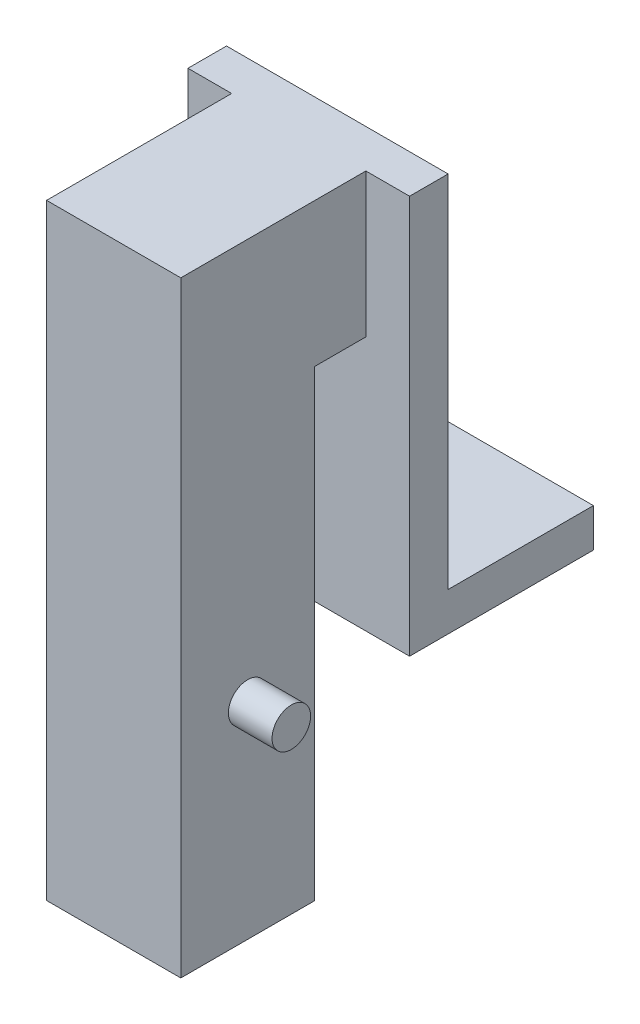
from build123d import *

# Parameters (mm, degrees)
SKETCH1_W           = 10.442861366
SKETCH1_H           = 47.180745659
BOSS_EXTRUDE1_DEPTH = 10.4
SKETCH2_W           = 4.442861366
SKETCH2_H           = 4.4
CUT_EXTRUDE1_DEPTH  = 25
WRAP1_START         = 6.090842934
WRAP1_OUTLINE_R     = 1.5
WRAP1_DEPTH         = 3.4
WRAP2_START         = -7.752018432
WRAP2_OUTLINE_R     = 1.5
WRAP2_DEPTH         = 3.4
SKETCH9_W           = 14.4
SKETCH9_H           = 11.180745659
BOSS_EXTRUDE2_DEPTH = 10.442861366
SKETCH10_W          = 17.242861366
SKETCH10_H          = 28
BOSS_EXTRUDE3_DEPTH = 3
SKETCH11_W          = 17.242861366
SKETCH11_H          = 14.30503792
BOSS_EXTRUDE4_DEPTH = 3


# Read off the part's stored shape, not the designer's step: Wrap1, Wrap2
with BuildPart() as part:
    # Sketch1 → Boss-Extrude1 (new body)
    with BuildSketch(Plane.XY):
        with Locations((0.869412251, 15.507053004)):
            Rectangle(SKETCH1_W, SKETCH1_H)
    extrude(amount=-BOSS_EXTRUDE1_DEPTH)

    # Sketch2 → Cut-Extrude1 (cut)
    with BuildSketch(Plane(origin=(0, -8.083319826, 0), x_dir=(-1, 0, 0), z_dir=(0, -1, 0))):
        with Locations((-0.869412251, 5.2)):
            Rectangle(SKETCH2_W, SKETCH2_H)
    extrude(amount=-CUT_EXTRUDE1_DEPTH, mode=Mode.SUBTRACT)

    # Wrap1 outline → Wrap1 (add)
    with BuildSketch(Plane(origin=(0, 0, 0), x_dir=(0, 0, -1), z_dir=(1, 0, 0)).offset(WRAP1_START)):
        with Locations((5.2, 7.916680174)):
            Circle(WRAP1_OUTLINE_R)
    extrude(amount=WRAP1_DEPTH)

    # Wrap2 outline → Wrap2 (add)
    with BuildSketch(Plane(origin=(0, 0, 0), x_dir=(0, 0, -1), z_dir=(1, 0, 0)).offset(WRAP2_START)):
        with Locations((5.2, 7.916680174)):
            Circle(WRAP2_OUTLINE_R)
    extrude(amount=WRAP2_DEPTH)

    # Sketch9 → Boss-Extrude2 (add)
    with BuildSketch(Plane(origin=(6.090842934, 0, 0), x_dir=(0, 0, -1), z_dir=(1, 0, 0))):
        with Locations((7.2, 33.507053004)):
            Rectangle(SKETCH9_W, SKETCH9_H)
    extrude(amount=-BOSS_EXTRUDE2_DEPTH)

    # Sketch10 → Boss-Extrude3 (add)
    with BuildSketch(Plane(origin=(0, 0, -14.4), x_dir=(-1, 0, 0), z_dir=(0, 0, -1))):
        with Locations((-0.869412251, 25.097425833)):
            Rectangle(SKETCH10_W, SKETCH10_H)
    extrude(amount=BOSS_EXTRUDE3_DEPTH)

    # Sketch11 → Boss-Extrude4 (add)
    with BuildSketch(Plane(origin=(0, 11.097425833, 0), x_dir=(-1, 0, 0), z_dir=(0, -1, 0))):
        with Locations((-0.869412251, 21.55251896)):
            Rectangle(SKETCH11_W, SKETCH11_H)
    extrude(amount=BOSS_EXTRUDE4_DEPTH)


solid = part.part
